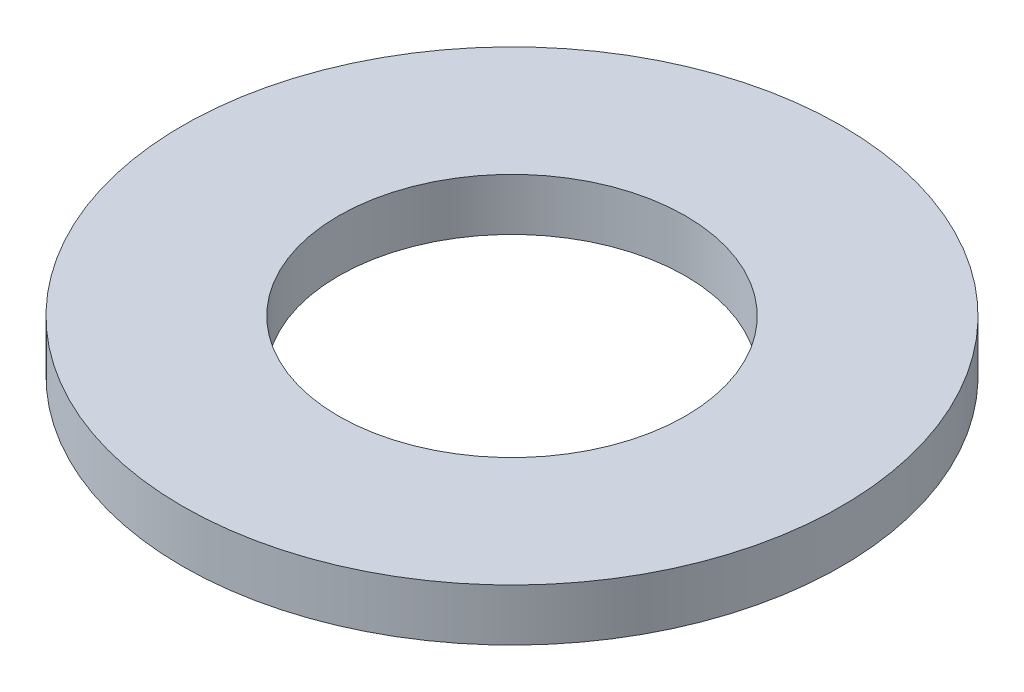
from build123d import *

# Parameters (mm, degrees)
SKETCH1_R           = 95
BOSS_EXTRUDE1_DEPTH = 15
SKETCH2_R           = 50
CUT_EXTRUDE1_DEPTH  = 136.185058346


with BuildPart() as part:
    # Sketch1 → Boss-Extrude1 (new body)
    with BuildSketch(Plane(origin=(0, 0, 0), x_dir=(1, 0, 0), z_dir=(0, 1, 0))):
        Circle(SKETCH1_R)
    extrude(amount=BOSS_EXTRUDE1_DEPTH)

    # Sketch2 → Cut-Extrude1 (cut, through all)
    with BuildSketch(Plane(origin=(0, 0, 0), x_dir=(1, 0, 0), z_dir=(0, 1, 0))):
        Circle(SKETCH2_R)
    extrude(amount=CUT_EXTRUDE1_DEPTH, mode=Mode.SUBTRACT)


solid = part.part
